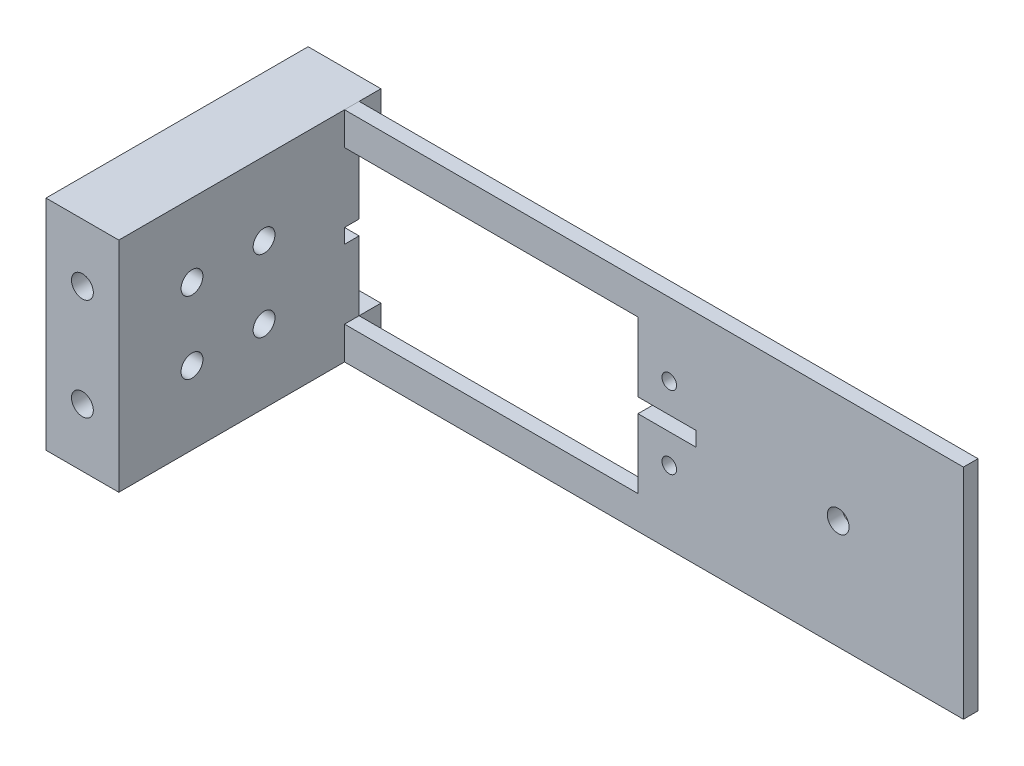
from build123d import *

# Parameters (mm, degrees)
EXTRUDE_1_DEPTH     = 30
SKETCH_2_R          = 1.5
CUT_EXTRUDE_1_DEPTH = 106.929221653
SKETCH_3_W          = 40.3
SKETCH_3_H          = 21
CUT_EXTRUDE_2_DEPTH = 106.929221653
SKETCH_4_W          = 8
SKETCH_4_H          = 21
CUT_EXTRUDE_3_DEPTH = 3
SKETCH_5_W          = 56.3
SKETCH_5_H          = 2
CUT_EXTRUDE_4_DEPTH = 5
SKETCH_6_R          = 1
CUT_EXTRUDE_5_DEPTH = 4
SKETCH_7_R          = 1.5
CUT_EXTRUDE_6_DEPTH = 106.929221653
SKETCH_8_R          = 1.5
CUT_EXTRUDE_7_DEPTH = 4


with BuildPart() as part:
    # Эскиз1 → Бобышка-Вытянуть1 (new body)
    with BuildSketch(Plane(origin=(0, 0, 0), x_dir=(1, 0, 0), z_dir=(0, 1, 0))):
        Polygon((0, 0), (10, 0), (10, 31), (95, 31), (95, 33), (10, 33), (10, 36), (0, 36), align=None)
    extrude(amount=EXTRUDE_1_DEPTH)

    # Эскиз2 → Вырез-Вытянуть1 (cut, through all)
    with BuildSketch(Plane.ZY):
        with Locations((-19.949747468, 19.949747468)):
            Circle(SKETCH_2_R)
        with Locations((-10.050252532, 19.949747468)):
            Circle(SKETCH_2_R)
        with Locations((-19.949747468, 10.050252532)):
            Circle(SKETCH_2_R)
        with Locations((-10.050252532, 10.050252532)):
            Circle(SKETCH_2_R)
    extrude(amount=-CUT_EXTRUDE_1_DEPTH, mode=Mode.SUBTRACT)

    # Эскиз3 → Вырез-Вытянуть2 (cut, through all)
    with BuildSketch(Plane(origin=(0, 0, -36), x_dir=(-1, 0, 0), z_dir=(0, 0, -1))):
        with Locations((-30.15, 15)):
            Rectangle(SKETCH_3_W, SKETCH_3_H)
    extrude(amount=-CUT_EXTRUDE_2_DEPTH, mode=Mode.SUBTRACT)

    # Эскиз4 → Вырез-Вытянуть3 (cut)
    with BuildSketch(Plane(origin=(0, 0, -36), x_dir=(-1, 0, 0), z_dir=(0, 0, -1))):
        with Locations((-6, 15)):
            Rectangle(SKETCH_4_W, SKETCH_4_H)
    extrude(amount=-CUT_EXTRUDE_3_DEPTH, mode=Mode.SUBTRACT)

    # Эскиз5 → Вырез-Вытянуть4 (cut)
    with BuildSketch(Plane(origin=(0, 0, -36), x_dir=(-1, 0, 0), z_dir=(0, 0, -1))):
        with Locations((-30.15, 15)):
            Rectangle(SKETCH_5_W, SKETCH_5_H)
    extrude(amount=-CUT_EXTRUDE_4_DEPTH, mode=Mode.SUBTRACT)

    # Эскиз6 → Вырез-Вытянуть5 (cut)
    with BuildSketch(Plane(origin=(0, 0, -33), x_dir=(-1, 0, 0), z_dir=(0, 0, -1))):
        with Locations((-5.4, 10)):
            Circle(SKETCH_6_R)
        with Locations((-54.6, 10)):
            Circle(SKETCH_6_R)
        with Locations((-5.4, 20)):
            Circle(SKETCH_6_R)
        with Locations((-54.6, 20)):
            Circle(SKETCH_6_R)
    extrude(amount=-CUT_EXTRUDE_5_DEPTH, mode=Mode.SUBTRACT)

    # Эскиз7 → Вырез-Вытянуть6 (cut, through all)
    with BuildSketch(Plane(origin=(0, 0, -36), x_dir=(-1, 0, 0), z_dir=(0, 0, -1))):
        with Locations((-77.8, 15)):
            Circle(SKETCH_7_R)
    extrude(amount=-CUT_EXTRUDE_6_DEPTH, mode=Mode.SUBTRACT)

    # Эскиз8 → Вырез-Вытянуть7 (cut)
    with BuildSketch(Plane.XY):
        with Locations((5, 22)):
            Circle(SKETCH_8_R)
        with Locations((5, 8)):
            Circle(SKETCH_8_R)
    extrude(amount=-CUT_EXTRUDE_7_DEPTH, mode=Mode.SUBTRACT)


with BuildPart() as body_2:
    # Split Bodies 1: the piece on the far side of the plane
    add(part.part)
    split(bisect_by=Plane(origin=(10, 30, 0), x_dir=(0, 0, -1), z_dir=(-1, 0, 0)), keep=Keep.BOTTOM)


with BuildPart() as part_1:
    add(part.part)

    # Split Bodies 1
    split(bisect_by=Plane(origin=(10, 30, 0), x_dir=(0, 0, -1), z_dir=(-1, 0, 0)), keep=Keep.TOP)


solid = Compound([body_2.part, part_1.part])
